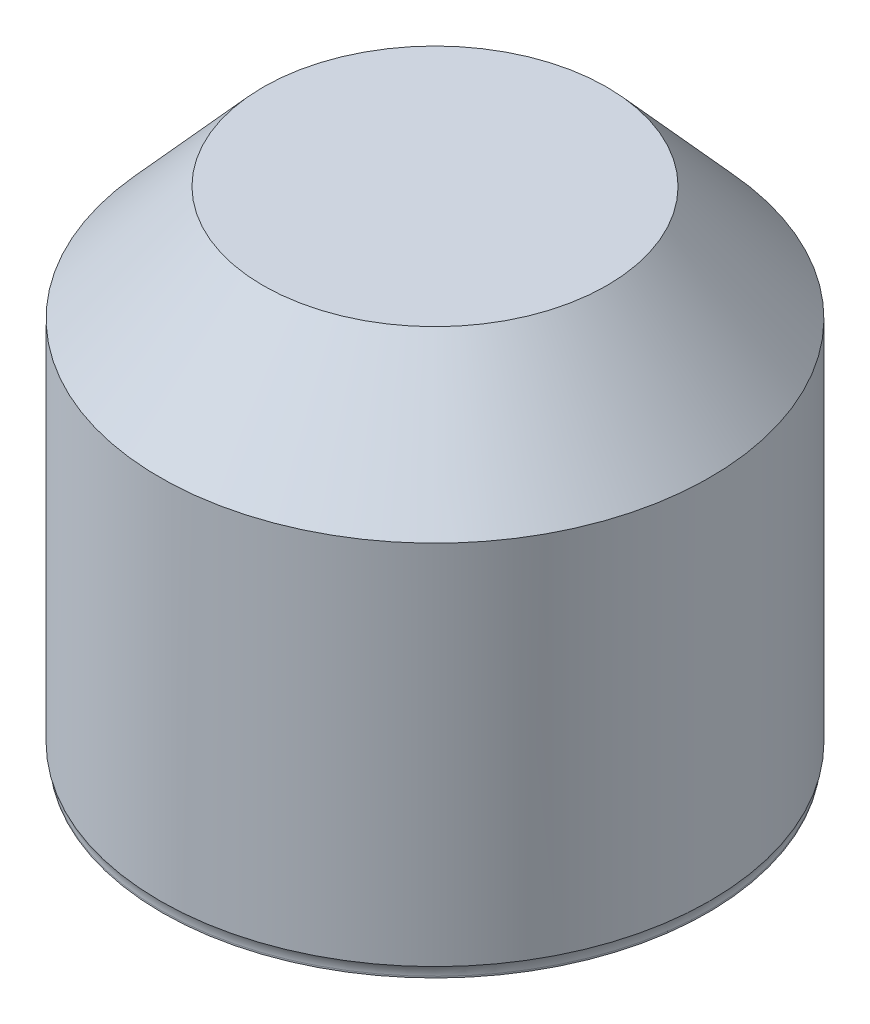
from build123d import *

# Parameters (mm, degrees)
SKETCH1_R           = 59.5
SKETCH1_R_2         = 52
BOSS_EXTRUDE1_DEPTH = 2.5
SKETCH2_R           = 60
SKETCH2_R_2         = 46.365
BOSS_EXTRUDE2_DEPTH = 70
SKETCH3_R           = 60
BOSS_EXTRUDE3_DEPTH = 10
FILLET1_R           = 1
SKETCH4_R           = 37.5
FILLET2_R           = 5
FILLET3_R           = 5


with BuildPart() as part:
    # Sketch1 → Boss-Extrude1 (new body)
    with BuildSketch(Plane(origin=(0, 0, 0), x_dir=(1, 0, 0), z_dir=(0, 1, 0))):
        with Locations(Location((0, 0, 0), (0, 0, 270))):
            Circle(SKETCH1_R)
        with Locations(Location((0, 0, 0), (0, 0, 270))):
            Circle(SKETCH1_R_2, mode=Mode.SUBTRACT)
    extrude(amount=BOSS_EXTRUDE1_DEPTH)

    # Sketch2 → Boss-Extrude2 (add)
    with BuildSketch(Plane(origin=(0, 2.5, 0), x_dir=(1, 0, 0), z_dir=(0, 1, 0))):
        with Locations(Location((0, 0, 0), (0, 0, 270))):
            Circle(SKETCH2_R)
        with Locations(Location((0, 0, 0), (0, 0, 270))):
            Circle(SKETCH2_R_2, mode=Mode.SUBTRACT)
    extrude(amount=BOSS_EXTRUDE2_DEPTH)

    # Sketch3 → Boss-Extrude3 (add)
    with BuildSketch(Plane(origin=(0, 72.5, 0), x_dir=(1, 0, 0), z_dir=(0, 1, 0))):
        with Locations(Location((0, 0, 0), (0, 0, 270))):
            Circle(SKETCH3_R)
    extrude(amount=BOSS_EXTRUDE3_DEPTH)

    # Fillet1
    fillet1_edges = [part.edges().sort_by_distance(p)[0] for p in [
        (0, 2.5, -46.365),
    ]]
    fillet(fillet1_edges, radius=FILLET1_R)

    # Sketch4 → section 1 of loft1
    with BuildSketch(Plane(origin=(0, 107.5, 0), x_dir=(1, 0, 0), z_dir=(0, 1, 0)), mode=Mode.PRIVATE) as loft1_s1:
        Circle(SKETCH4_R)
    # loft up to a face of the part (loft1)
    loft([Face(Wire([part.edges().sort_by_distance((43.738117645, 82.5, -41.072826356))[0]])), loft1_s1.sketch])

    # Fillet2
    fillet2_edges = [part.edges().sort_by_distance(p)[0] for p in [
        (0, 72.5, -46.365),
    ]]
    fillet(fillet2_edges, radius=FILLET2_R)

    # Fillet3
    # the kernel refuses this fillet: 5 mm, written as the material it adds along each edge
    with BuildSketch(Plane(origin=(0, 2.5, 0), x_dir=(0, 0, 1), z_dir=(-1, 0, 0))) as fillet3_piece_1:
        with BuildLine():
            CenterArc((64.5, -2.179449472), FILLET3_R, 154.158067237, 25.841932763)
            Line((60, 0), (59.5, 0))
            Line((59.5, 0), (59.5, -2.179449472))
        make_face()
    revolve(axis=Axis((0, 2.5, 0), (0, 1, 0)))


solid = part.part
